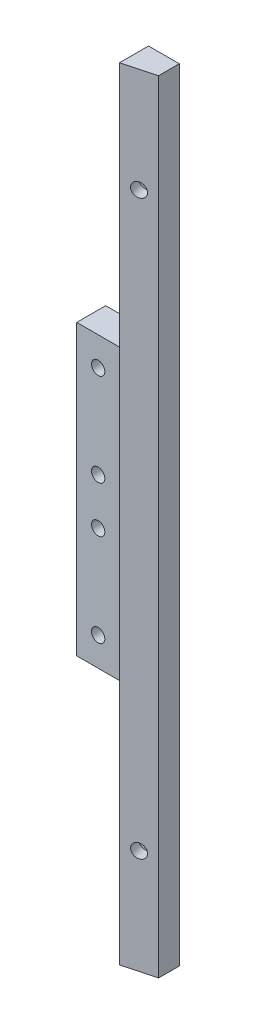
from build123d import *

# Parameters (mm, degrees)
SKETCH2_W           = 14.8
SKETCH2_H           = 99.8
BOSS_EXTRUDE1_DEPTH = 10
BOSS_EXTRUDE2_START = -486.761258468
BOSS_EXTRUDE2_DEPTH = 270
SKETCH5_R           = 2.4
CUT_EXTRUDE1_DEPTH  = 4


# Read off the part's stored shape, not the designer's step: Boss-Extrude2
with BuildPart() as part:
    # Sketch2 → Boss-Extrude1 (new body)
    with BuildSketch(Plane.XY):
        with Locations((-106.280981946, -351.761258468)):
            Rectangle(SKETCH2_W, SKETCH2_H)
        with BuildLine():
            ThreePointArc((-103.980981946, -391.761258468), (-106.280981946, -389.461258468), (-108.580981946, -391.761258468))
            ThreePointArc((-108.580981946, -391.761258468), (-106.280981946, -394.061258468), (-103.980981946, -391.761258468))
        make_face(mode=Mode.SUBTRACT)
        with BuildLine():
            ThreePointArc((-108.580981946, -359.761258468), (-106.280981946, -362.061258468), (-103.980981946, -359.761258468))
            ThreePointArc((-103.980981946, -359.761258468), (-106.280981946, -357.461258468), (-108.580981946, -359.761258468))
        make_face(mode=Mode.SUBTRACT)
        with BuildLine():
            ThreePointArc((-108.580981946, -343.761258468), (-106.280981946, -346.061258468), (-103.980981946, -343.761258468))
            ThreePointArc((-103.980981946, -343.761258468), (-106.280981946, -341.461258468), (-108.580981946, -343.761258468))
        make_face(mode=Mode.SUBTRACT)
        with BuildLine():
            ThreePointArc((-108.580981946, -311.761258468), (-106.280981946, -314.061258468), (-103.980981946, -311.761258468))
            ThreePointArc((-103.980981946, -311.761258468), (-106.280981946, -309.461258468), (-108.580981946, -311.761258468))
        make_face(mode=Mode.SUBTRACT)
    extrude(amount=BOSS_EXTRUDE1_DEPTH)

    # Boss-Extrude2 outline → Boss-Extrude2 (add)
    with BuildSketch(Plane(origin=(0, 0, 0), x_dir=(1, 0, 0), z_dir=(0, 1, 0)).offset(BOSS_EXTRUDE2_START)):
        Polygon((-88.255797857, -7.152990504), (-88.255797857, 0), (-98.880981946, 0), (-98.880981946, -10), align=None)
    extrude(amount=BOSS_EXTRUDE2_DEPTH)

    # Sketch5 → Cut-Extrude1 (cut)
    with BuildSketch(Plane(origin=(-4.123769815, 0, -15.390118468), x_dir=(0.9659258262890692, 0, -0.25881904510251785), z_dir=(0.25881904510251785, 0, 0.9659258262890692))):
        with Locations((-92.599884641, -252.871258468)):
            Circle(SKETCH5_R)
        with Locations((-92.599884641, -450.651258468)):
            Circle(SKETCH5_R)
    extrude(amount=-CUT_EXTRUDE1_DEPTH, mode=Mode.SUBTRACT)


solid = part.part
